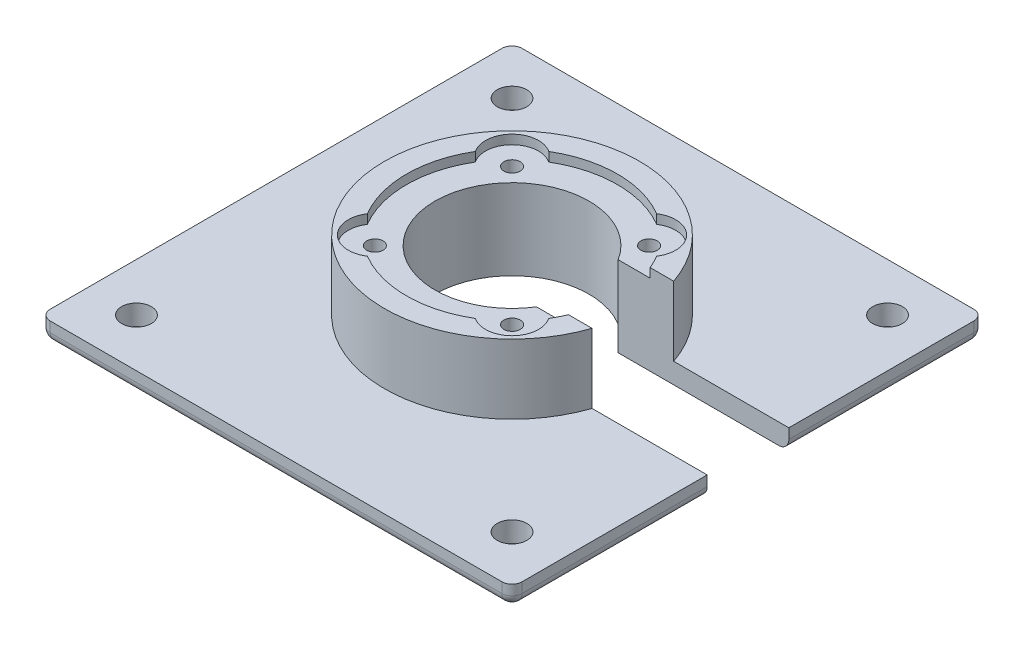
from build123d import *

# Parameters (mm, degrees)
SKETCH3_R                   = 12.5
SKETCH3_R_2                 = 7.55
BOSS_EXTRUDE2_DEPTH         = 8.8
SKETCH4_W                   = 6.878404869
SKETCH4_H                   = 8
CUT_EXTRUDE2_DEPTH          = 8.8
SKETCH8_R                   = 10.34
CUT_EXTRUDE5_DEPTH          = 0.9
TAP_DRILL_FOR_M2X0_4_TAP1_D = 1.6
CUT_EXTRUDE6_DEPTH          = 0.9
BOSS_EXTRUDE4_DEPTH         = 2
FILLET2_R                   = 1
FILLET3_R                   = 1
M2_5_CLEARANCE_HOLE1_D      = 2.9
FILLET4_R                   = 1
FILLET5_R                   = 1


with BuildPart() as part:
    # Sketch3 → Boss-Extrude2 (new body)
    with BuildSketch(Plane(origin=(0, 0, 0), x_dir=(1, 0, 0), z_dir=(0, 1, 0))):
        with Locations(Location((0, 0, 0), (0, 0, 270))):
            Circle(SKETCH3_R)
        with Locations(Location((0, 0, 0), (0, 0, 270))):
            Circle(SKETCH3_R_2, mode=Mode.SUBTRACT)
    extrude(amount=BOSS_EXTRUDE2_DEPTH)

    # Sketch4 → Cut-Extrude2 (cut)
    with BuildSketch(Plane(origin=(0, 8.8, 0), x_dir=(1, 0, 0), z_dir=(0, 1, 0))):
        with Locations((9.842521887, 0)):
            Rectangle(SKETCH4_W, SKETCH4_H)
    extrude(amount=-CUT_EXTRUDE2_DEPTH, mode=Mode.SUBTRACT)

    # Sketch8 → Cut-Extrude5 (cut)
    with BuildSketch(Plane(origin=(0, 8.8, 0), x_dir=(1, 0, 0), z_dir=(0, 1, 0))):
        Circle(SKETCH8_R)
    extrude(amount=-CUT_EXTRUDE5_DEPTH, mode=Mode.SUBTRACT)

    # Tap Drill for M2x0.4 Tap1 (through all)
    with Locations(Plane(origin=(6.72, 8.8, 6.715027923), x_dir=(0, 0, 1), z_dir=(0, 1, 0))):
        with Locations((0, 0), (0.004972077, -13.435027923), (-13.435027923, -13.435027923), (-13.430055846, 0)):
            Hole(TAP_DRILL_FOR_M2X0_4_TAP1_D / 2)

    # Sketch11 → Cut-Extrude6 (cut)
    with BuildSketch(Plane(origin=(0, 8.8, 0), x_dir=(1, 0, 0), z_dir=(0, 1, 0))):
        with BuildLine():
            Line((8.889256072, 5.281735177), (5.288313257, 8.885344275))
            ThreePointArc((5.288313257, 8.885344275), (8.559157895, 8.552825038), (8.889256072, 5.281735177))
        make_face()
        with BuildLine():
            Line((8.889256072, -5.281735177), (5.288313257, -8.885344275))
            ThreePointArc((5.288313257, -8.885344275), (8.559157895, -8.552825038), (8.889256072, -5.281735177))
        make_face()
        with BuildLine():
            Line((-5.281735177, -8.889256072), (-8.885344275, -5.288313257))
            ThreePointArc((-8.885344275, -5.288313257), (-8.552825038, -8.559157895), (-5.281735177, -8.889256072))
        make_face()
        with BuildLine():
            Line((-5.281735177, 8.889256072), (-8.885344275, 5.288313257))
            ThreePointArc((-8.885344275, 5.288313257), (-8.552825038, 8.559157895), (-5.281735177, 8.889256072))
        make_face()
    extrude(amount=-CUT_EXTRUDE6_DEPTH, mode=Mode.SUBTRACT)

    # Sketch12 → Boss-Extrude4 (add)
    with BuildSketch(Plane.XZ):
        with BuildLine():
            Line((23.125, -23.125), (-23.125, -23.125))
            Line((-23.125, -23.125), (-23.125, 23.125))
            Line((-23.125, 23.125), (23.125, 23.125))
            Line((23.125, 23.125), (23.125, 4))
            Line((23.125, 4), (6.403319452, 4))
            ThreePointArc((6.403319452, 4), (-7.55, 0), (6.403319452, -4))
            Line((6.403319452, -4), (23.125, -4))
            Line((23.125, -4), (23.125, -23.125))
        make_face()
    extrude(amount=-BOSS_EXTRUDE4_DEPTH)

    # Fillet2
    fillet2_edges = [part.edges().sort_by_distance(p)[0] for p in [
        (0, 0, 23.125),
        (-23.125, 0, 0),
    ]]
    fillet(fillet2_edges, radius=FILLET2_R)

    # Fillet3
    # the kernel refuses this fillet: 1 mm, written as the material it takes off along each edge
    with BuildSketch(Plane(origin=(-22.125, 1, 22.125), x_dir=(0, 0, 1), z_dir=(-1, 0, 0))) as fillet3_piece_1_section:
        Polygon((0, 0), (FILLET3_R, 0), (FILLET3_R, -FILLET3_R), (0, -FILLET3_R), align=None)
    fillet3_piece_1 = extrude(amount=FILLET3_R, mode=Mode.PRIVATE)
    fillet3_piece_1 = fillet3_piece_1 - Plane(origin=(-22.125, 1, 22.125), x_dir=(0, 0.7071067811865475, -0.7071067811865475), z_dir=(-1, 0, 0)) * Sphere(FILLET3_R, mode=Mode.PRIVATE)
    add(fillet3_piece_1, mode=Mode.SUBTRACT)
    with BuildSketch(Plane(origin=(-23.125, 1, 23.125), x_dir=(0, 0, -1), z_dir=(0, 1, 0))) as fillet3_piece_2:
        with BuildLine():
            CenterArc((FILLET3_R, -FILLET3_R), FILLET3_R, 90, 90)
            Line((0, -FILLET3_R), (0, 0))
            Line((0, 0), (FILLET3_R, 0))
        make_face()
    extrude(amount=3.5, mode=Mode.SUBTRACT)

    # M2.5 Clearance Hole1 (through all)
    with Locations(Plane(origin=(18.3989, 0, 18.3989), x_dir=(0, 0, -1), z_dir=(0, -1, 0))):
        with Locations((0, 0), (36.7978, 0), (36.7978, -36.7978), (0, -36.7978)):
            Hole(M2_5_CLEARANCE_HOLE1_D / 2)

    # Fillet4
    fillet4_edges = [part.edges().sort_by_distance(p)[0] for p in [
        (23.125, 0, 13.0625),
        (23.125, 0, -13.5625),
        (-23.125, 1.5, -23.125),
        (23.125, 1.5, 23.125),
        (0.5, 0, -23.125),
        (-22.832106781, 0.292893219, -23.125),
        (23.125, 0.292893219, 22.832106781),
    ]]
    fillet(fillet4_edges, radius=FILLET4_R)

    # Fillet5
    # the kernel refuses this fillet: 1 mm, written as the material it takes off along each edge
    with BuildSketch(Plane(origin=(22.125, 1, -22.125), x_dir=(1, 0, 0), z_dir=(0, 0, -1))) as fillet5_piece_1_section:
        Polygon((0, 0), (FILLET5_R, 0), (FILLET5_R, FILLET5_R), (0, FILLET5_R), align=None)
    fillet5_piece_1 = extrude(amount=FILLET5_R, mode=Mode.PRIVATE)
    fillet5_piece_1 = fillet5_piece_1 - Plane(origin=(22.125, 1, -22.125), x_dir=(-0.7071067811865475, 0.7071067811865475, 0), z_dir=(0, 0, -1)) * Sphere(FILLET5_R, mode=Mode.PRIVATE)
    add(fillet5_piece_1, mode=Mode.SUBTRACT)
    with BuildSketch(Plane(origin=(23.125, 1, -23.125), x_dir=(-1, 0, 0), z_dir=(0, 1, 0))) as fillet5_piece_2:
        with BuildLine():
            CenterArc((FILLET5_R, FILLET5_R), FILLET5_R, 180, 90)
            Line((0, FILLET5_R), (0, 0))
            Line((0, 0), (FILLET5_R, 0))
        make_face()
    extrude(amount=3.5, mode=Mode.SUBTRACT)


solid = part.part
